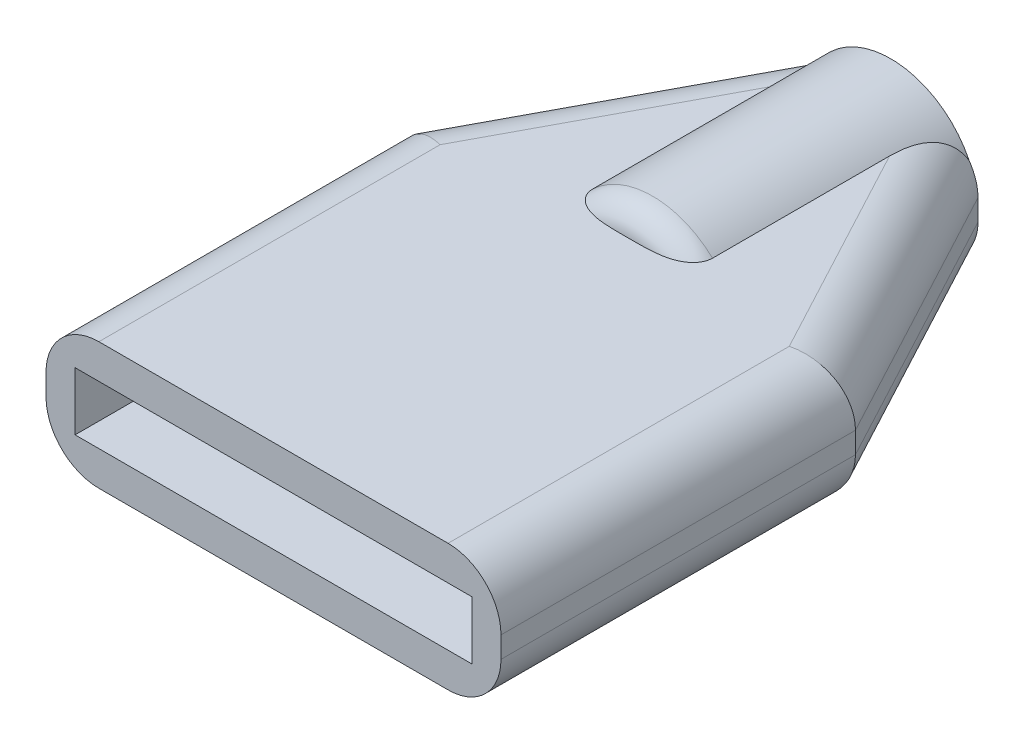
from build123d import *

# Parameters (mm, degrees)
SKETCH1_W           = 25.8
SKETCH1_H           = 35
BOSS_EXTRUDE1_DEPTH = 7.2
SKETCH3_W           = 22.5
SKETCH3_H           = 3.3
CUT_EXTRUDE1_DEPTH  = 20.5
BOSS_EXTRUDE2_DEPTH = 14.9
SKETCH6_R           = 2.95
CUT_EXTRUDE3_DEPTH  = 13.5
FILLET1_R           = 1.4
FILLET2_R           = 1.4
CUT_EXTRUDE4_DEPTH  = 13.5
FILLET5_R           = 3


with BuildPart() as part:
    # Sketch1 → Boss-Extrude1 (new body)
    with BuildSketch(Plane(origin=(0, 0, 0), x_dir=(1, 0, 0), z_dir=(0, 1, 0))):
        with Locations((12.9, -17.5)):
            Rectangle(SKETCH1_W, SKETCH1_H)
    extrude(amount=BOSS_EXTRUDE1_DEPTH)

    # Sketch3 → Cut-Extrude1 (cut)
    with BuildSketch(Plane.XY.offset(35)):
        with Locations((12.9, 3.6)):
            Rectangle(SKETCH3_W, SKETCH3_H)
    extrude(amount=-CUT_EXTRUDE1_DEPTH, mode=Mode.SUBTRACT)

    # Sketch5 → Boss-Extrude2 (add)
    with BuildSketch(Plane(origin=(0, 0, 0), x_dir=(-1, 0, 0), z_dir=(0, 0, -1))):
        with BuildLine():
            Line((-16.297425496, 7.2), (-12.9, 7.2))
            Line((-12.9, 7.2), (-9.502574504, 7.2))
            ThreePointArc((-9.502574504, 7.2), (-12.9, 8.55), (-16.297425496, 7.2))
        make_face()
        with BuildLine():
            Line((-9.502574504, 0), (-12.9, 0))
            Line((-12.9, 0), (-16.297425496, 0))
            ThreePointArc((-16.297425496, 0), (-12.9, -1.35), (-9.502574504, 0))
        make_face()
    extrude(amount=-BOSS_EXTRUDE2_DEPTH)

    # Sketch6 → Cut-Extrude3 (cut)
    with BuildSketch(Plane(origin=(0, 0, 0), x_dir=(-1, 0, 0), z_dir=(0, 0, -1))):
        with Locations((-12.9, 3.6)):
            Circle(SKETCH6_R)
    extrude(amount=-CUT_EXTRUDE3_DEPTH, mode=Mode.SUBTRACT)

    # Fillet1
    # the kernel refuses this fillet: 1.4 mm, written as the material it takes off along each edge
    with BuildSketch(Plane(origin=(12.9, 3.6, 14.9), x_dir=(-0.9942803452588228, 0.10680166212187986, 0), z_dir=(-0.10680166212187986, -0.9942803452588228, 0))) as fillet1_piece_1_section:
        with BuildLine():
            CenterArc((4.95 - FILLET1_R, FILLET1_R), FILLET1_R, 270, 90)
            Line((4.95 - FILLET1_R, 0), (4.95, 0))
            Line((4.95, 0), (4.95, FILLET1_R))
        make_face()
    fillet1_piece_1 = revolve(axis=Axis((12.9, 3.6, 14.9), (0, 0, -1)), revolution_arc=167.738044053, mode=Mode.PRIVATE)
    fillet1_piece_1 = split(fillet1_piece_1, bisect_by=Plane(origin=(12.9, 7.2, 14.482271144), z_dir=(0, 1, 0)), keep=Keep.TOP, mode=Mode.PRIVATE)
    add(fillet1_piece_1, mode=Mode.SUBTRACT)

    # Fillet2
    # the kernel refuses this fillet: 1.4 mm, written as the material it takes off along each edge
    with BuildSketch(Plane(origin=(12.9, 3.6, 14.9), x_dir=(0.9942803452588191, -0.10680166212191289, 0), z_dir=(0.10680166212191289, 0.9942803452588191, 0))) as fillet2_piece_1_section:
        with BuildLine():
            CenterArc((4.95 - FILLET2_R, FILLET2_R), FILLET2_R, 270, 90)
            Line((4.95 - FILLET2_R, 0), (4.95, 0))
            Line((4.95, 0), (4.95, FILLET2_R))
        make_face()
    fillet2_piece_1 = revolve(axis=Axis((12.9, 3.6, 14.9), (0, 0, -1)), revolution_arc=167.738044053, mode=Mode.PRIVATE)
    fillet2_piece_1 = split(fillet2_piece_1, bisect_by=Plane(origin=(12.9, 0, 14.482271144), z_dir=(0, -1, 0)), keep=Keep.TOP, mode=Mode.PRIVATE)
    add(fillet2_piece_1, mode=Mode.SUBTRACT)

    # Sketch7 → Cut-Extrude4 (cut)
    with BuildSketch(Plane(origin=(0, 0, 0), x_dir=(-1, 0, 0), z_dir=(0, -1, 0))):
        Polygon((-17.85, 0), (-25.8, 0), (-25.8, -14.9), align=None)
        Polygon((0, -14.9), (0, 0), (-7.95, 0), align=None)
    extrude(amount=-CUT_EXTRUDE4_DEPTH, mode=Mode.SUBTRACT)

    # Fillet5
    # the kernel refuses this fillet: 3 mm, written as the material it takes off along each edge
    with BuildSketch(Plane(origin=(25.8, 7.2, 7.4), x_dir=(-1, 0, 0), z_dir=(0, 0, 1)), Plane(origin=(0, 7.2, 42.5), x_dir=(1, 0, 0), z_dir=(0, 0, -1))) as fillet5_piece_1:
        with BuildLine():
            CenterArc((FILLET5_R, FILLET5_R), FILLET5_R, 180, 90)
            Line((0, FILLET5_R), (0, 0))
            Line((0, 0), (FILLET5_R, 0))
        make_face()
    extrude(amount=35.1, mode=Mode.SUBTRACT)
    with BuildSketch(Plane(origin=(25.8, 0, 7.4), x_dir=(-1, 0, 0), z_dir=(0, 0, 1)), Plane(origin=(0, 0, 42.5), x_dir=(1, 0, 0), z_dir=(0, 0, -1))) as fillet5_piece_2:
        with BuildLine():
            CenterArc((FILLET5_R, -FILLET5_R), FILLET5_R, 90, 90)
            Line((0, -FILLET5_R), (0, 0))
            Line((0, 0), (FILLET5_R, 0))
        make_face()
    extrude(amount=35.1, mode=Mode.SUBTRACT)
    with BuildSketch(Plane(origin=(29.33056421, 7.2, 21.517032293), x_dir=(0, -1, 0), z_dir=(-0.4707418946375641, 0, -0.8822709723395848))) as fillet5_piece_3_section:
        with BuildLine():
            CenterArc((FILLET5_R, FILLET5_R), FILLET5_R, 180, 90)
            Line((0, FILLET5_R), (0, 0))
            Line((0, 0), (FILLET5_R, 0))
        make_face()
    fillet5_piece_3 = extrude(amount=31.88823555, mode=Mode.PRIVATE)
    fillet5_piece_3 = fillet5_piece_3 - Plane(origin=(12.9, 3.6, 8.289630093), x_dir=(-0.6863485850246219, 0.7272727272727194, 0), z_dir=(0, 0, -1)) * Cylinder(4.95, 76, mode=Mode.PRIVATE)
    add(fillet5_piece_3, mode=Mode.SUBTRACT)
    with BuildSketch(Plane(origin=(29.33056421, 0, 21.517032293), x_dir=(-0.8822709723395848, 0, 0.4707418946375641), z_dir=(-0.4707418946375641, 0, -0.8822709723395848))) as fillet5_piece_4_section:
        with BuildLine():
            CenterArc((FILLET5_R, FILLET5_R), FILLET5_R, 180, 90)
            Line((0, FILLET5_R), (0, 0))
            Line((0, 0), (FILLET5_R, 0))
        make_face()
    fillet5_piece_4 = extrude(amount=31.88823555, mode=Mode.PRIVATE)
    fillet5_piece_4 = fillet5_piece_4 - Plane(origin=(12.9, 3.6, 8.289627813), x_dir=(0.6863485850245981, -0.727272727272742, 0), z_dir=(0, 0, -1)) * Cylinder(4.95, 76, mode=Mode.PRIVATE)
    add(fillet5_piece_4, mode=Mode.SUBTRACT)
    with BuildSketch(Plane(origin=(11.48056421, 7.2, -6.617032293), x_dir=(0.8822709723395851, 0, 0.4707418946375639), z_dir=(-0.4707418946375639, 0, 0.882270972339585))) as fillet5_piece_5_section:
        with BuildLine():
            CenterArc((FILLET5_R, -FILLET5_R), FILLET5_R, 90, 90)
            Line((0, -FILLET5_R), (0, 0))
            Line((0, 0), (FILLET5_R, 0))
        make_face()
    fillet5_piece_5 = extrude(amount=31.88823555, mode=Mode.PRIVATE)
    fillet5_piece_5 = fillet5_piece_5 - Plane(origin=(12.9, 3.6, 8.289627632), x_dir=(-0.6863485850246219, 0.7272727272727194, 0), z_dir=(0, 0, -1)) * Cylinder(4.95, 76, mode=Mode.PRIVATE)
    add(fillet5_piece_5, mode=Mode.SUBTRACT)
    with BuildSketch(Plane(origin=(11.48056421, 0, -6.617032293), x_dir=(0.8822709723395851, 0, 0.4707418946375639), z_dir=(-0.4707418946375639, 0, 0.882270972339585))) as fillet5_piece_6_section:
        with BuildLine():
            CenterArc((FILLET5_R, FILLET5_R), FILLET5_R, 180, 90)
            Line((0, FILLET5_R), (0, 0))
            Line((0, 0), (FILLET5_R, 0))
        make_face()
    fillet5_piece_6 = extrude(amount=31.88823555, mode=Mode.PRIVATE)
    fillet5_piece_6 = fillet5_piece_6 - Plane(origin=(12.9, 3.6, 8.289629174), x_dir=(0.6863485850245981, -0.727272727272742, 0), z_dir=(0, 0, -1)) * Cylinder(4.95, 76, mode=Mode.PRIVATE)
    add(fillet5_piece_6, mode=Mode.SUBTRACT)


solid = part.part
